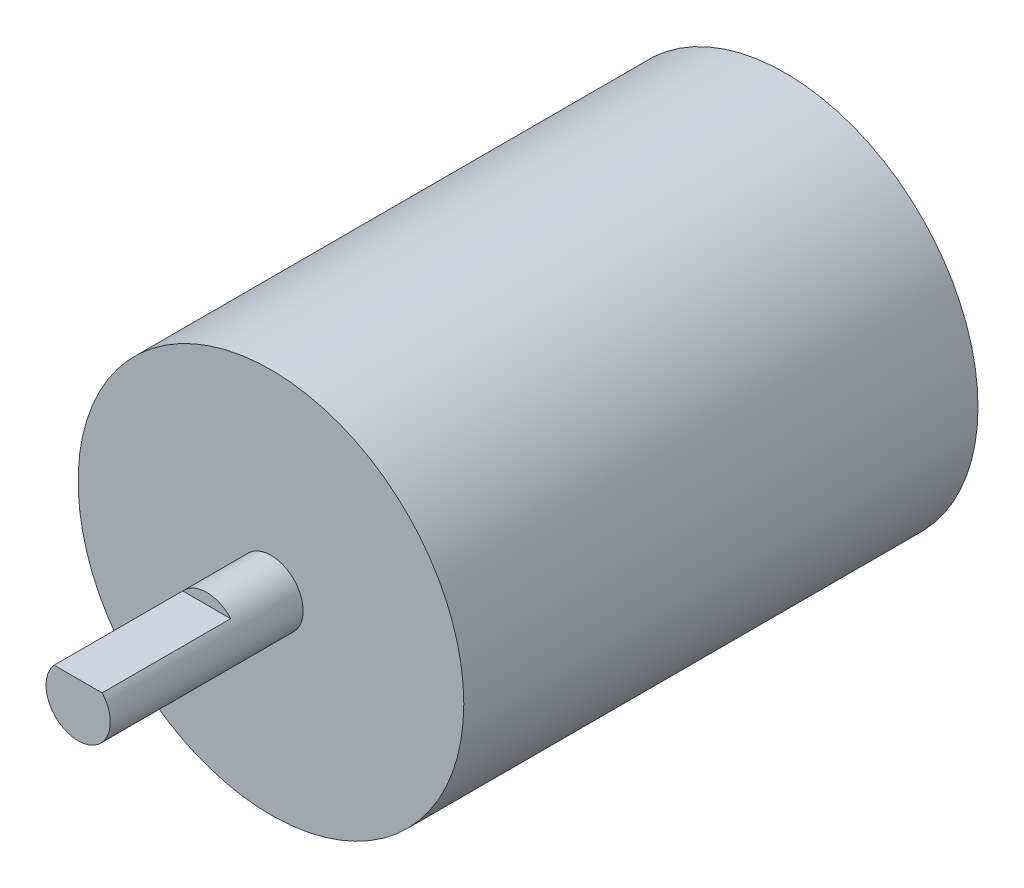
from build123d import *

# Parameters (mm, degrees)
SKETCH1_R           = 19.05
BOSS_EXTRUDE1_DEPTH = 50.8
SKETCH2_R           = 3.175
BOSS_EXTRUDE2_DEPTH = 19.05
SKETCH3_W           = 7.575380866
SKETCH3_H           = 1.446687318
CUT_EXTRUDE1_DEPTH  = 12.7


with BuildPart() as part:
    # Sketch1 → Boss-Extrude1 (new body)
    with BuildSketch(Plane.XY):
        Circle(SKETCH1_R)
    extrude(amount=BOSS_EXTRUDE1_DEPTH)

    # Sketch2 → Boss-Extrude2 (add)
    with BuildSketch(Plane.XY.offset(50.8)):
        Circle(SKETCH2_R)
    extrude(amount=BOSS_EXTRUDE2_DEPTH)

    # Sketch3 → Cut-Extrude1 (cut)
    with BuildSketch(Plane.XY.offset(69.85)):
        with Locations((0.155919731, 2.835726074)):
            Rectangle(SKETCH3_W, SKETCH3_H)
    extrude(amount=-CUT_EXTRUDE1_DEPTH, mode=Mode.SUBTRACT)


solid = part.part
